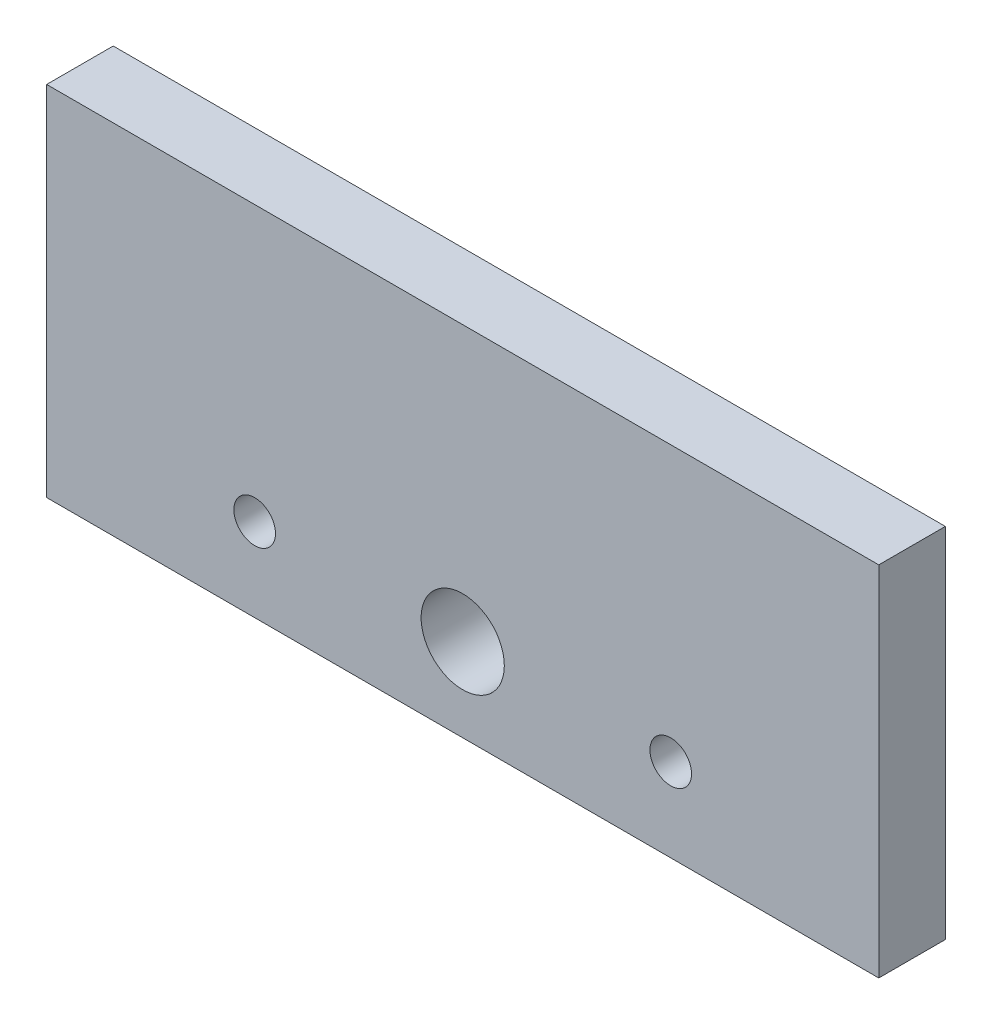
from build123d import *

# Parameters (mm, degrees)
SKETCH_2_W             = 100
SKETCH_2_H             = 43
EXTRUDE_1_DEPTH        = 8
SKETCH_3_R             = 5
CUT_EXTRUDE_1_DEPTH    = 8
HOLE_WIZARD_M6_1_D     = 5
HOLE_WIZARD_M6_1_DEPTH = 15
HOLE_WIZARD_M6_1_TIP   = 1.502151548


with BuildPart() as part:
    # 草图2 → 凸台-拉伸1 (new body)
    with BuildSketch(Plane.XY):
        with Locations((50, 21.5)):
            Rectangle(SKETCH_2_W, SKETCH_2_H)
    extrude(amount=EXTRUDE_1_DEPTH)

    # 草图3 → 切除-拉伸1 (cut)
    with BuildSketch(Plane.XY.offset(8)):
        with Locations((50, 10)):
            Circle(SKETCH_3_R)
    extrude(amount=-CUT_EXTRUDE_1_DEPTH, mode=Mode.SUBTRACT)

    # M6 螺纹孔1
    with Locations(Plane.XY.offset(8)):
        with Locations((25, 10), (75, 10)):
            Hole(HOLE_WIZARD_M6_1_D / 2, depth=HOLE_WIZARD_M6_1_DEPTH)
            with Locations((0, 0, -(HOLE_WIZARD_M6_1_DEPTH + HOLE_WIZARD_M6_1_TIP / 2))):  # 118° drill point
                Cone(0, HOLE_WIZARD_M6_1_D / 2, HOLE_WIZARD_M6_1_TIP, mode=Mode.SUBTRACT)


solid = part.part
